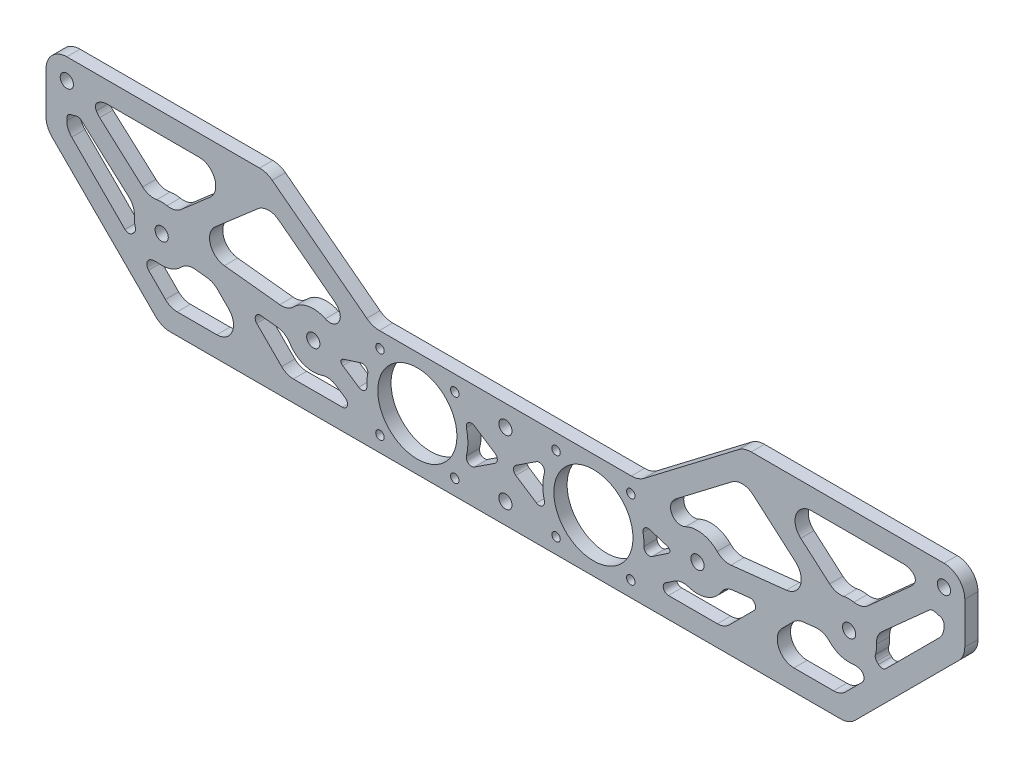
from build123d import *

# Parameters (mm, degrees)
SKETCH1_R           = 14.2875
SKETCH1_R_2         = 3.175
BOSS_EXTRUDE1_DEPTH = 6.35
FILLET1_R           = 10
CUT_EXTRUDE1_DEPTH  = 10
FILLET2_R           = 2.5
FILLET3_DEPTH       = 6.35
FILLET4_R           = 8
FILLET5_R           = 8
FILLET6_R           = 3
FILLET7_R           = 8
FILLET8_R           = 5
FILLET9_R           = 3
FILLET10_R          = 8
SKETCH3_R           = 19
CUT_EXTRUDE2_DEPTH  = 10
SKETCH4_R           = 2.032
CUT_EXTRUDE3_DEPTH  = 10


with BuildPart() as part:
    # Sketch1 → Boss-Extrude1 (new body)
    with BuildSketch(Plane.XY):
        Polygon((-62.442934658, -37.279495554), (267.757065342, -37.279495554), (323.315335232, 18.278774336), (323.315335232, 52.320504446), (217.352871158, 52.320504446), (166.552871158, 13.520504446), (38.761259526, 13.520504446), (-12.038740474, 52.320504446), (-118.001204548, 52.320504446), (-118.001204548, 18.278774336), align=None)
        with Locations((60.373820223, -11.879495554)):
            Circle(SKETCH1_R, mode=Mode.SUBTRACT)
        with Locations((-62.442934658, 1.520504446)):
            Circle(SKETCH1_R_2, mode=Mode.SUBTRACT)
        with Locations((10.373820223, -6.424213816)):
            Circle(SKETCH1_R_2, mode=Mode.SUBTRACT)
        with Locations((102.657065342, -27.279495554)):
            Circle(SKETCH1_R_2, mode=Mode.SUBTRACT)
        with Locations((144.940310462, -11.879495554)):
            Circle(SKETCH1_R, mode=Mode.SUBTRACT)
        with Locations((194.940310462, -6.424213816)):
            Circle(SKETCH1_R_2, mode=Mode.SUBTRACT)
        with Locations((102.657065342, 3.520504446)):
            Circle(SKETCH1_R_2, mode=Mode.SUBTRACT)
        with Locations((267.757065342, 1.520504446)):
            Circle(SKETCH1_R_2, mode=Mode.SUBTRACT)
        with Locations((313.315335232, 42.320504446)):
            Circle(SKETCH1_R_2, mode=Mode.SUBTRACT)
        with Locations((-108.001204548, 42.320504446)):
            Circle(SKETCH1_R_2, mode=Mode.SUBTRACT)
    extrude(amount=BOSS_EXTRUDE1_DEPTH)

    # Fillet1
    fillet1_edges = [part.edges().sort_by_distance(p)[0] for p in [
        (-118.001204548, 18.278774336, 3.175),
        (-118.001204548, 52.320504446, 3.175),
        (-12.038740474, 52.320504446, 3.175),
        (38.761259526, 13.520504446, 3.175),
        (166.552871158, 13.520504446, 3.175),
        (217.352871158, 52.320504446, 3.175),
        (323.315335232, 52.320504446, 3.175),
        (323.315335232, 18.278774336, 3.175),
        (267.757065342, -37.279495554, 3.175),
        (-62.442934658, -37.279495554, 3.175),
    ]]
    fillet(fillet1_edges, radius=FILLET1_R)

    # Sketch2 → Cut-Extrude1 (cut)
    with BuildSketch(Plane.XY.offset(6.35)):
        with BuildLine():
            ThreePointArc((23.505920872, -7.486549706), (23.419545179, -8.265323632), (23.28702714, -9.037585605))
            Line((23.28702714, -9.037585605), (36.905820905, -18.135345959))
            ThreePointArc((36.905820905, -18.135345959), (36.127690836, -10.462503664), (37.794303215, -2.932536966))
            Line((37.794303215, -2.932536966), (23.505920872, -7.486549706))
        make_face()
        with BuildLine():
            Line((-74.858923583, 5.927753475), (-102.256554243, 30.463876853))
            ThreePointArc((-102.256554243, 30.463876853), (-105.054209768, 29.479326667), (-108.001204548, 29.145504446))
            Line((-108.001204548, 29.145504446), (-108.001204548, 22.42090996))
            Line((-108.001204548, 22.42090996), (-78.307400752, -7.272893836))
            Line((-78.307400752, -7.272893836), (-74.597651385, -3.563144469))
            ThreePointArc((-74.597651385, -3.563144469), (-75.612945288, 1.157951013), (-74.858923583, 5.927753475))
        make_face()
        with BuildLine():
            Line((-23.050139283, 42.320504446), (-94.826204548, 42.320504446))
            ThreePointArc((-94.826204548, 42.320504446), (-95.017343814, 40.084439722), (-95.585215622, 37.913255418))
            Line((-95.585215622, 37.913255418), (-68.187584962, 13.377132039))
            ThreePointArc((-68.187584962, 13.377132039), (-62.339595002, 14.695099162), (-56.512999229, 13.285558242))
            Line((-56.512999229, 13.285558242), (-23.050139283, 42.320504446))
        make_face()
        with BuildLine():
            Line((-67.526583573, -10.63421228), (-71.23633294, -14.343961648))
            Line((-71.23633294, -14.343961648), (-58.300799034, -27.279495554))
            Line((-58.300799034, -27.279495554), (-16.619224161, -27.279495554))
            Line((-16.619224161, -27.279495554), (-37.688728757, -6.209990957))
            Line((-37.688728757, -6.209990957), (-50.867789262, -4.772081195))
            ThreePointArc((-50.867789262, -4.772081195), (-58.069603335, -10.907471984), (-67.526583573, -10.63421228))
        make_face()
        with BuildLine():
            Line((30.003625706, 7.626245825), (-11.363222422, 39.221397545))
            Line((-11.363222422, 39.221397545), (-49.959338032, 5.732444651))
            ThreePointArc((-49.959338032, 5.732444651), (-49.868096719, 5.45167168), (-49.783169494, 5.168924788))
            Line((-49.783169494, 5.168924788), (-1.201325173, -0.131628174))
            ThreePointArc((-1.201325173, -0.131628174), (9.059387493, 6.685053578), (20.46921657, 2.041221648))
            Line((20.46921657, 2.041221648), (32.642653903, 5.921156225))
            ThreePointArc((32.642653903, 5.921156225), (31.289604918, 6.721797881), (30.003625706, 7.626245825))
        make_face()
        with BuildLine():
            Line((-21.814640677, -7.941943413), (-2.477088537, -27.279495554))
            Line((-2.477088537, -27.279495554), (32.591759865, -27.279495554))
            Line((32.591759865, -27.279495554), (17.732180345, -17.352853315))
            ThreePointArc((17.732180345, -17.352853315), (5.870863239, -18.805813204), (-2.285944941, -10.072634157))
            Line((-2.285944941, -10.072634157), (-21.814640677, -7.941943413))
        make_face()
        with BuildLine():
            Line((187.581950339, -17.352853315), (172.722370819, -27.279495554))
            Line((172.722370819, -27.279495554), (207.791219222, -27.279495554))
            Line((207.791219222, -27.279495554), (227.128771362, -7.941943413))
            Line((227.128771362, -7.941943413), (207.600075626, -10.072634157))
            ThreePointArc((207.600075626, -10.072634157), (199.443267446, -18.805813204), (187.581950339, -17.352853315))
        make_face()
        with BuildLine():
            Line((243.002859442, -6.209990957), (221.933354845, -27.279495554))
            Line((221.933354845, -27.279495554), (263.614929719, -27.279495554))
            Line((263.614929719, -27.279495554), (276.550463625, -14.343961648))
            Line((276.550463625, -14.343961648), (272.840714257, -10.63421228))
            ThreePointArc((272.840714257, -10.63421228), (263.38373402, -10.907471984), (256.181919946, -4.772081195))
            Line((256.181919946, -4.772081195), (243.002859442, -6.209990957))
        make_face()
        with BuildLine():
            Line((168.408309779, -18.135345959), (182.027103545, -9.037585605))
            ThreePointArc((182.027103545, -9.037585605), (181.894585505, -8.265323632), (181.808209813, -7.486549706))
            Line((181.808209813, -7.486549706), (167.519827469, -2.932536966))
            ThreePointArc((167.519827469, -2.932536966), (169.186439849, -10.462503664), (168.408309779, -18.135345959))
        make_face()
        with BuildLine():
            ThreePointArc((175.310504979, 7.626245825), (174.024525767, 6.721797881), (172.671476782, 5.921156225))
            Line((172.671476782, 5.921156225), (184.844914115, 2.041221648))
            ThreePointArc((184.844914115, 2.041221648), (196.254743191, 6.685053578), (206.515455858, -0.131628174))
            Line((206.515455858, -0.131628174), (255.097300178, 5.168924788))
            ThreePointArc((255.097300178, 5.168924788), (255.182227404, 5.45167168), (255.273468717, 5.732444651))
            Line((255.273468717, 5.732444651), (216.677353107, 39.221397545))
            Line((216.677353107, 39.221397545), (175.310504979, 7.626245825))
        make_face()
        with BuildLine():
            Line((279.911782069, -3.563144469), (283.621531436, -7.272893836))
            Line((283.621531436, -7.272893836), (313.315335232, 22.42090996))
            Line((313.315335232, 22.42090996), (313.315335232, 29.145504446))
            ThreePointArc((313.315335232, 29.145504446), (310.368340453, 29.479326667), (307.570684928, 30.463876853))
            Line((307.570684928, 30.463876853), (280.173054268, 5.927753475))
            ThreePointArc((280.173054268, 5.927753475), (280.927075973, 1.157951013), (279.911782069, -3.563144469))
        make_face()
        with BuildLine():
            Line((228.364269968, 42.320504446), (261.827129914, 13.285558242))
            ThreePointArc((261.827129914, 13.285558242), (267.653725687, 14.695099162), (273.501715647, 13.377132039))
            Line((273.501715647, 13.377132039), (300.899346307, 37.913255418))
            ThreePointArc((300.899346307, 37.913255418), (300.331474499, 40.084439722), (300.140335232, 42.320504446))
            Line((300.140335232, 42.320504446), (228.364269968, 42.320504446))
        make_face()
        with BuildLine():
            Line((124.499254422, 1.237130698), (104.481636284, -11.879495554))
            Line((104.481636284, -11.879495554), (124.499254422, -24.996121805))
            ThreePointArc((124.499254422, -24.996121805), (120.652810462, -11.879495554), (124.499254422, 1.237130698))
        make_face()
        with BuildLine():
            Line((100.832494401, -11.879495554), (80.814876263, 1.237130698))
            ThreePointArc((80.814876263, 1.237130698), (84.661320223, -11.879495554), (80.814876263, -24.996121805))
            Line((80.814876263, -24.996121805), (100.832494401, -11.879495554))
        make_face()
    extrude(amount=-CUT_EXTRUDE1_DEPTH, mode=Mode.SUBTRACT)

    # Fillet2
    # the kernel refuses this fillet: 2.5 mm, written as the material it adds along each edge
    with BuildSketch(Plane(origin=(124.499254422, -24.996121805, 6.35), x_dir=(-0.8364298099761919, 0.5480740579366914, 0), z_dir=(0, 0, -1)), Plane(origin=(80.814876263, 1.237130698, 6.35), x_dir=(0.8364298099761912, -0.5480740579366923, 0), z_dir=(0, 0, -1))) as fillet2_piece_1:
        with BuildLine():
            CenterArc((8.270761151, 2.5), FILLET2_R, 132.738385679, 137.261614321)
            ThreePointArc((6.574131455, 4.336150232), (3.463988922, 1.899838021), (0, 0))
            Line((0, 0), (8.270761151, 0))
        make_face()
    extrude(amount=6.35)
    with BuildSketch(Plane(origin=(104.481636284, -11.879495554, 6.35), x_dir=(0.836429809976191, 0.5480740579366925, 0), z_dir=(0, 0, -1)), Plane(origin=(100.832494401, -11.879495554, 6.35), x_dir=(-0.836429809976192, -0.5480740579366911, 0), z_dir=(0, 0, -1))) as fillet2_piece_2:
        with BuildLine():
            CenterArc((FILLET2_R * 1.52612552604, FILLET2_R), FILLET2_R, 156.469970738, 113.530029262)
            Line((FILLET2_R * 0.609274565772, FILLET2_R * 1.39922965403), (0, 0))
            Line((0, 0), (FILLET2_R * 1.52612552604, 0))
        make_face()
    extrude(amount=6.35)
    with BuildSketch(Plane(origin=(124.499254422, 1.237130698, 6.35), x_dir=(-0.8364298099761911, -0.5480740579366926, 0), z_dir=(0, 0, -1)), Plane(origin=(80.814876263, -24.996121805, 6.35), x_dir=(0.8364298099761913, 0.5480740579366921, 0), z_dir=(0, 0, -1))) as fillet2_piece_3:
        with BuildLine():
            CenterArc((8.270761151, -2.5), FILLET2_R, 90, 137.261614321)
            ThreePointArc((6.574131455, -4.336150232), (3.463988922, -1.899838021), (0, 0))
            Line((0, 0), (8.270761151, 0))
        make_face()
    extrude(amount=6.35)
    with BuildSketch(Plane(origin=(36.905820905, -18.135345959, 6.35), x_dir=(-0.8315267709778132, 0.5554846794891928, 0), z_dir=(0, 0, -1))) as fillet2_piece_4:
        with BuildLine():
            CenterArc((5.637586761, 2.5), FILLET2_R, 144.019234869, 125.980765131)
            ThreePointArc((3.614551073, 3.968784057), (1.917261006, 1.884223289), (0, 0))
            Line((0, 0), (5.637586761, 0))
        make_face()
    extrude(amount=6.35)
    with BuildSketch(Plane(origin=(37.794303215, -2.932536966, 6.35), x_dir=(-0.9527771354410546, -0.3036704302047504, 0), z_dir=(0, 0, -1))) as fillet2_piece_5:
        with BuildLine():
            CenterArc((4.690805929, -2.5), FILLET2_R, 90, 118.741955759)
            ThreePointArc((2.498820236, -3.702164183), (1.334695889, -1.793517434), (0, 0))
            Line((0, 0), (4.690805929, 0))
        make_face()
    extrude(amount=6.35)
    with BuildSketch(Plane(origin=(23.28702714, -9.037585605, 6.35), x_dir=(0.14435302535723496, 0.989526252340085, 0), z_dir=(0, 0, -1)), Plane(origin=(181.808209813, -7.486549706, 6.35), x_dir=(0.13512930422682767, -0.9908279725255911, 0), z_dir=(0, 0, -1)), Plane(origin=(307.570684928, 30.463876853, 6.35), x_dir=(0.9224742738611128, -0.3860585629984297, 0), z_dir=(0, 0, -1))) as fillet2_piece_6:
        with BuildLine():
            CenterArc((1.580869434, 2.496243903), FILLET2_R, 205.444288667, 61.414548907)
            Line((-0.676639225, 1.422160733), (0, 0))
            ThreePointArc((0, 0), (0.721939507, 0.019794629), (1.443879015, 0))
        make_face()
    extrude(amount=6.35)
    with BuildSketch(Plane(origin=(23.505920872, -7.486549706, 6.35), x_dir=(0.9527771354410546, 0.3036704302047506, 0), z_dir=(0, 0, -1)), Plane(origin=(182.027103545, -9.037585605, 6.35), x_dir=(-0.8315267709778119, -0.5554846794891947, 0), z_dir=(0, 0, -1)), Plane(origin=(-74.597651385, -3.563144469, 6.35), x_dir=(-0.7071067811865465, -0.7071067811865487, 0), z_dir=(0, 0, -1)), Plane(origin=(-102.256554243, 30.463876853, 6.35), x_dir=(0.7449378564648427, -0.667133862133804, 0), z_dir=(0, 0, -1))) as fillet2_piece_7:
        with BuildLine():
            CenterArc((1.574922789, 2.5), FILLET2_R, 208.585451093, 61.414548907)
            ThreePointArc((-0.62033846, 1.303827751), (-0.292294611, 0.660418307), (0, 0))
            Line((0, 0), (1.574922789, 0))
        make_face()
    extrude(amount=6.35)
    with BuildSketch(Plane(origin=(168.408309779, -18.135345959, 6.35), x_dir=(0.8315267709778126, 0.555484679489194, 0), z_dir=(0, 0, -1))) as fillet2_piece_8:
        with BuildLine():
            CenterArc((5.637586761, -2.5), FILLET2_R, 90, 125.980765131)
            ThreePointArc((3.614551073, -3.968784057), (1.917261006, -1.884223289), (0, 0))
            Line((0, 0), (5.637586761, 0))
        make_face()
    extrude(amount=6.35)
    with BuildSketch(Plane(origin=(167.519827469, -2.932536966, 6.35), x_dir=(0.9527771354410542, -0.3036704302047514, 0), z_dir=(0, 0, -1))) as fillet2_piece_9:
        with BuildLine():
            CenterArc((4.690805929, 2.5), FILLET2_R, 151.258044241, 118.741955759)
            ThreePointArc((2.498820236, 3.702164183), (1.334695889, 1.793517434), (0, 0))
            Line((0, 0), (4.690805929, 0))
        make_face()
    extrude(amount=6.35)
    with BuildSketch(Plane(origin=(-21.814640677, -7.941943413, 6.35), x_dir=(0.9941005983250841, -0.10846197679237511, 0), z_dir=(0, 0, -1)), Plane(origin=(227.128771362, -7.941943413, 6.35), x_dir=(-0.7071067811865478, -0.7071067811865472, 0), z_dir=(0, 0, -1))) as fillet2_piece_10:
        with BuildLine():
            CenterArc((FILLET2_R * 2.8417642098, FILLET2_R), FILLET2_R, 128.773337141, 141.226662859)
            Line((FILLET2_R * 2.21552313484, FILLET2_R * 1.77962947355), (0, 0))
            Line((0, 0), (FILLET2_R * 2.8417642098, 0))
        make_face()
    extrude(amount=6.35)
    with BuildSketch(Plane(origin=(32.591759865, -27.279495554, 6.35), x_dir=(-1, 0, 0), z_dir=(0, 0, -1)), Plane(origin=(172.722370819, -27.279495554, 6.35), x_dir=(0.8315267709778129, 0.5554846794891936, 0), z_dir=(0, 0, -1))) as fillet2_piece_11:
        with BuildLine():
            CenterArc((FILLET2_R * 3.2971688304, FILLET2_R), FILLET2_R, 123.74410479, 146.25589521)
            Line((FILLET2_R * 2.74168415091, FILLET2_R * 1.83152677098), (0, 0))
            Line((0, 0), (FILLET2_R * 3.2971688304, 0))
        make_face()
    extrude(amount=6.35)
    with BuildSketch(Plane(origin=(279.911782069, -3.563144469, 6.35), x_dir=(0.7071067811865567, -0.7071067811865384, 0), z_dir=(0, 0, -1))) as fillet2_piece_12:
        with BuildLine():
            CenterArc((1.574922789, -2.5), FILLET2_R, 90, 61.414548907)
            ThreePointArc((-0.62033846, -1.303827751), (-0.292294611, -0.660418307), (0, 0))
            Line((0, 0), (1.574922789, 0))
        make_face()
    extrude(amount=6.35)
    with BuildSketch(Plane(origin=(283.621531436, -7.272893836, 6.35), x_dir=(-0.707106781186556, 0.7071067811865389, 0), z_dir=(0, 0, -1))) as fillet2_piece_13:
        with BuildLine():
            CenterArc((FILLET2_R, FILLET2_R), FILLET2_R, 180, 90)
            Line((0, FILLET2_R), (0, 0))
            Line((0, 0), (FILLET2_R, 0))
        make_face()
    extrude(amount=6.35)
    with BuildSketch(Plane(origin=(-78.307400752, -7.272893836, 6.35), x_dir=(0.7071067811865476, 0.7071067811865476, 0), z_dir=(0, 0, -1))) as fillet2_piece_14:
        with BuildLine():
            CenterArc((FILLET2_R, -FILLET2_R), FILLET2_R, 90, 90)
            Line((0, -FILLET2_R), (0, 0))
            Line((0, 0), (FILLET2_R, 0))
        make_face()
    extrude(amount=6.35)
    with BuildSketch(Plane(origin=(-108.001204548, 29.145504446, 6.35), x_dir=(0.996794764075885, 0.08000123943352926, 0), z_dir=(0, 0, -1))) as fillet2_piece_15:
        with BuildLine():
            CenterArc((2.308035758, 2.49198691), FILLET2_R, 184.588636978, 80.822726043)
            Line((-0.183951153, 2.291983812), (0, 0))
            ThreePointArc((0, 0), (1.05401633, 0.042228983), (2.108032659, 0))
        make_face()
    extrude(amount=6.35)
    with BuildSketch(Plane(origin=(313.315335232, 29.145504446, 6.35), x_dir=(0, -1, 0), z_dir=(0, 0, -1))) as fillet2_piece_16:
        with BuildLine():
            CenterArc((2.299353783, 2.5), FILLET2_R, 189.177273957, 80.822726043)
            ThreePointArc((-0.168645225, 2.101275917), (-0.042228983, 1.05401633), (0, 0))
            Line((0, 0), (2.299353783, 0))
        make_face()
    extrude(amount=6.35)

    # Fillet3: read off the stored shape, not the designer's step
    # Fillet3 outline → Fillet3 (add)
    with BuildSketch(Plane.XY):
        with BuildLine():
            ThreePointArc((211.014076866, 0.359196726), (207.431725827, 0.786667832), (204.401466543, 2.744600208))
            ThreePointArc((204.401466543, 2.744600208), (205.556320418, 1.37841123), (206.515455858, -0.131628174))
            Line((206.515455858, -0.131628174), (211.014076866, 0.359196726))
        make_face()
        with BuildLine():
            Line((172.671476782, 5.921156225), (184.844914115, 2.041221648))
            ThreePointArc((184.844914115, 2.041221648), (181.600857992, 8.411550009), (184.744728864, 14.831912887))
            Line((184.744728864, 14.831912887), (175.310504979, 7.626245825))
            ThreePointArc((175.310504979, 7.626245825), (174.024525767, 6.721797881), (172.671476782, 5.921156225))
        make_face()
        with BuildLine():
            ThreePointArc((253.267424296, 7.473042793), (254.289203208, 6.405834356), (255.097300178, 5.168924788))
            ThreePointArc((255.097300178, 5.168924788), (255.182227404, 5.45167168), (255.273468717, 5.732444651))
            Line((255.273468717, 5.732444651), (253.267424296, 7.473042793))
        make_face()
        with BuildLine():
            Line((216.677353107, 39.221397545), (211.499590999, 35.266728848))
            ThreePointArc((211.499590999, 35.266728848), (216.60505587, 36.90513128), (221.598403693, 34.951516272))
            Line((221.598403693, 34.951516272), (216.677353107, 39.221397545))
        make_face()
        with BuildLine():
            ThreePointArc((0.912664141, 2.744600208), (-2.117595142, 0.786667832), (-5.699946181, 0.359196726))
            Line((-5.699946181, 0.359196726), (-1.201325173, -0.131628174))
            ThreePointArc((-1.201325173, -0.131628174), (-0.242189733, 1.37841123), (0.912664141, 2.744600208))
        make_face()
        with BuildLine():
            ThreePointArc((-49.959338032, 5.732444651), (-49.868096719, 5.45167168), (-49.783169494, 5.168924788))
            ThreePointArc((-49.783169494, 5.168924788), (-48.975072523, 6.405834356), (-47.953293611, 7.473042793))
            Line((-47.953293611, 7.473042793), (-49.959338032, 5.732444651))
        make_face()
        with BuildLine():
            ThreePointArc((20.56940182, 14.831912887), (23.713272692, 8.411550009), (20.46921657, 2.041221648))
            Line((20.46921657, 2.041221648), (32.642653903, 5.921156225))
            ThreePointArc((32.642653903, 5.921156225), (31.289604918, 6.721797881), (30.003625706, 7.626245825))
            Line((30.003625706, 7.626245825), (20.56940182, 14.831912887))
        make_face()
        with BuildLine():
            Line((-11.363222422, 39.221397545), (-16.284273008, 34.951516272))
            ThreePointArc((-16.284273008, 34.951516272), (-11.290925185, 36.90513128), (-6.185460314, 35.266728848))
            Line((-6.185460314, 35.266728848), (-11.363222422, 39.221397545))
        make_face()
        with BuildLine():
            Line((-58.300799034, -27.279495554), (-54.987090535, -27.279495554))
            ThreePointArc((-54.987090535, -27.279495554), (-58.048557994, -26.670531814), (-60.643944784, -24.936349803))
            Line((-60.643944784, -24.936349803), (-58.300799034, -27.279495554))
        make_face()
        with BuildLine():
            ThreePointArc((-30.27607841, -13.622641304), (-28.5418964, -22.340963013), (-35.93293266, -27.279495554))
            Line((-35.93293266, -27.279495554), (-16.619224161, -27.279495554))
            Line((-16.619224161, -27.279495554), (-30.27607841, -13.622641304))
        make_face()
        with BuildLine():
            Line((-67.526583573, -10.63421228), (-70.726466387, -13.834095095))
            ThreePointArc((-70.726466387, -13.834095095), (-67.665859968, -11.923948803), (-64.077242842, -11.552737759))
            ThreePointArc((-64.077242842, -11.552737759), (-65.833164615, -11.210833497), (-67.526583573, -10.63421228))
        make_face()
        with BuildLine():
            ThreePointArc((-52.981778576, -7.648309578), (-49.951519293, -5.690377201), (-46.369168254, -5.262906096))
            Line((-46.369168254, -5.262906096), (-50.867789262, -4.772081195))
            ThreePointArc((-50.867789262, -4.772081195), (-51.826924702, -6.2821206), (-52.981778576, -7.648309578))
        make_face()
        with BuildLine():
            Line((221.933354845, -27.279495554), (241.247063344, -27.279495554))
            ThreePointArc((241.247063344, -27.279495554), (233.856027084, -22.340963013), (235.590209095, -13.622641304))
            Line((235.590209095, -13.622641304), (221.933354845, -27.279495554))
        make_face()
        with BuildLine():
            Line((256.181919946, -4.772081195), (251.683298938, -5.262906096))
            ThreePointArc((251.683298938, -5.262906096), (255.265649978, -5.690377201), (258.295909261, -7.648309578))
            ThreePointArc((258.295909261, -7.648309578), (257.141055386, -6.2821206), (256.181919946, -4.772081195))
        make_face()
        with BuildLine():
            ThreePointArc((269.391373527, -11.552737759), (272.979990652, -11.923948803), (276.040597072, -13.834095095))
            Line((276.040597072, -13.834095095), (272.840714257, -10.63421228))
            ThreePointArc((272.840714257, -10.63421228), (271.147295299, -11.210833497), (269.391373527, -11.552737759))
        make_face()
        with BuildLine():
            Line((313.315335232, 22.42090996), (313.315335232, 25.734618459))
            ThreePointArc((313.315335232, 25.734618459), (312.706371492, 22.673151), (310.972189482, 20.077764209))
            Line((310.972189482, 20.077764209), (313.315335232, 22.42090996))
        make_face()
        with BuildLine():
            Line((-108.001204548, 22.42090996), (-105.658058797, 20.077764209))
            ThreePointArc((-105.658058797, 20.077764209), (-107.392240808, 22.673151), (-108.001204548, 25.734618459))
            Line((-108.001204548, 25.734618459), (-108.001204548, 22.42090996))
        make_face()
        with BuildLine():
            ThreePointArc((-94.710843669, 39.231452318), (-91.910717066, 41.506865938), (-88.395577167, 42.320504446))
            Line((-88.395577167, 42.320504446), (-94.826204548, 42.320504446))
            ThreePointArc((-94.826204548, 42.320504446), (-95.017343814, 40.084439722), (-95.585215622, 37.913255418))
            Line((-95.585215622, 37.913255418), (-92.214135174, 34.89426276))
            ThreePointArc((-92.214135174, 34.89426276), (-93.810362745, 36.862603833), (-94.710843669, 39.231452318))
        make_face()
        with BuildLine():
            Line((-23.050139283, 42.320504446), (-44.477079813, 42.320504446))
            ThreePointArc((-44.477079813, 42.320504446), (-36.98241748, 37.118724686), (-39.234150855, 28.278013574))
            Line((-39.234150855, 28.278013574), (-23.050139283, 42.320504446))
        make_face()
        with BuildLine():
            ThreePointArc((-64.794001652, 14.484034405), (-68.39760622, 14.657252847), (-71.55866541, 16.396124697))
            Line((-71.55866541, 16.396124697), (-68.187584962, 13.377132039))
            ThreePointArc((-68.187584962, 13.377132039), (-66.528453946, 14.04604464), (-64.794001652, 14.484034405))
        make_face()
        with BuildLine():
            Line((-56.512999229, 13.285558242), (-53.094975386, 16.251298127))
            ThreePointArc((-53.094975386, 16.251298127), (-56.282922876, 14.562226986), (-59.888801275, 14.445558708))
            ThreePointArc((-59.888801275, 14.445558708), (-58.161433032, 13.980414913), (-56.512999229, 13.285558242))
        make_face()
        with BuildLine():
            ThreePointArc((300.024974354, 39.231452318), (299.12449343, 36.862603833), (297.528265858, 34.89426276))
            Line((297.528265858, 34.89426276), (300.899346307, 37.913255418))
            ThreePointArc((300.899346307, 37.913255418), (300.331474499, 40.084439722), (300.140335232, 42.320504446))
            Line((300.140335232, 42.320504446), (293.709707851, 42.320504446))
            ThreePointArc((293.709707851, 42.320504446), (297.224847751, 41.506865938), (300.024974354, 39.231452318))
        make_face()
        with BuildLine():
            Line((273.501715647, 13.377132039), (276.872796095, 16.396124697))
            ThreePointArc((276.872796095, 16.396124697), (273.711736905, 14.657252847), (270.108132336, 14.484034405))
            ThreePointArc((270.108132336, 14.484034405), (271.842584631, 14.04604464), (273.501715647, 13.377132039))
        make_face()
        with BuildLine():
            ThreePointArc((244.54828154, 28.278013574), (242.296548164, 37.118724686), (249.791210497, 42.320504446))
            Line((249.791210497, 42.320504446), (228.364269968, 42.320504446))
            Line((228.364269968, 42.320504446), (244.54828154, 28.278013574))
        make_face()
        with BuildLine():
            ThreePointArc((261.827129914, 13.285558242), (263.475563717, 13.980414913), (265.202931959, 14.445558708))
            ThreePointArc((265.202931959, 14.445558708), (261.59705356, 14.562226986), (258.409106071, 16.251298127))
            Line((258.409106071, 16.251298127), (261.827129914, 13.285558242))
        make_face()
        with BuildLine():
            ThreePointArc((280.900420623, 2.433103461), (281.468499861, 5.995863135), (283.544134716, 8.946746132))
            Line((283.544134716, 8.946746132), (280.173054268, 5.927753475))
            ThreePointArc((280.173054268, 5.927753475), (280.655637502, 4.205175982), (280.900420623, 2.433103461))
        make_face()
        with BuildLine():
            ThreePointArc((183.819027546, -19.866597953), (187.193607633, -18.590596485), (190.785655576, -18.926992218))
            ThreePointArc((190.785655576, -18.926992218), (189.130245318, -18.248923877), (187.581950339, -17.352853315))
            Line((187.581950339, -17.352853315), (183.819027546, -19.866597953))
        make_face()
        with BuildLine():
            ThreePointArc((206.156066314, -13.337060238), (208.692812831, -10.771736161), (212.098696634, -9.581809257))
            Line((212.098696634, -9.581809257), (207.600075626, -10.072634157))
            ThreePointArc((207.600075626, -10.072634157), (206.989138013, -11.753977379), (206.156066314, -13.337060238))
        make_face()
        with BuildLine():
            ThreePointArc((-6.784565949, -9.581809257), (-3.378682147, -10.771736161), (-0.84193563, -13.337060238))
            ThreePointArc((-0.84193563, -13.337060238), (-1.675007328, -11.753977378), (-2.285944941, -10.072634157))
            Line((-2.285944941, -10.072634157), (-6.784565949, -9.581809257))
        make_face()
        with BuildLine():
            ThreePointArc((17.732180345, -17.352853315), (16.183885366, -18.248923877), (14.528475108, -18.926992218))
            ThreePointArc((14.528475108, -18.926992218), (18.120523051, -18.590596485), (21.495103139, -19.866597953))
            Line((21.495103139, -19.866597953), (17.732180345, -17.352853315))
        make_face()
        with BuildLine():
            ThreePointArc((-78.230004032, 8.946746132), (-76.154369176, 5.995863135), (-75.586289939, 2.433103461))
            ThreePointArc((-75.586289939, 2.433103461), (-75.341506817, 4.205175982), (-74.858923583, 5.927753475))
            Line((-74.858923583, 5.927753475), (-78.230004032, 8.946746132))
        make_face()
    extrude(amount=FILLET3_DEPTH)

    # Fillet4
    fillet4_edges = [part.edges().sort_by_distance(p)[0] for p in [
        (-49.783169494, 5.168924788, 3.175),
        (255.097300178, 5.168924788, 3.175),
    ]]
    fillet(fillet4_edges, radius=FILLET4_R)

    # Fillet5
    # the kernel refuses this fillet: 8 mm, written as the material it adds along each edge
    with BuildSketch(Plane(origin=(276.550463625, -14.343961648, 6.35), x_dir=(-0.7071067811865465, -0.7071067811865486, 0), z_dir=(0, 0, -1))) as fillet5_piece_1:
        with BuildLine():
            CenterArc((3.319191964, 8), FILLET5_R, 245.487044087, 24.512955913)
            Line((0, 0.721060194), (-0.066383839, 0.575481398))
            ThreePointArc((-0.066383839, 0.575481398), (-0.16, 0.360530097), (-0.16, 0))
            Line((-0.16, 0), (0, -0.16))
            Line((0, -0.16), (3.319191964, -0.16))
            Line((3.319191964, -0.16), (3.319191964, 0))
        make_face()
    extrude(amount=6.35)
    with BuildSketch(Plane(origin=(-71.23633294, -14.343961648, 6.35), x_dir=(0.7071067811865467, -0.7071067811865483, 0), z_dir=(0, 0, -1))) as fillet5_piece_2:
        with BuildLine():
            CenterArc((3.319191965, -8), FILLET5_R, 90, 24.512955918)
            Line((0, -0.721060194), (-0.066383839, -0.575481398))
            ThreePointArc((-0.066383839, -0.575481398), (-0.16, -0.360530097), (-0.16, 0))
            Line((-0.16, 0), (0, 0.16))
            Line((0, 0.16), (3.319191965, 0.16))
            Line((3.319191965, 0.16), (3.319191965, 0))
        make_face()
    extrude(amount=6.35)

    # Fillet6
    fillet6_edges = [part.edges().sort_by_distance(p)[0] for p in [
        (276.040597072, -13.834095095, 3.175),
        (-70.726466387, -13.834095095, 3.175),
    ]]
    fillet(fillet6_edges, radius=FILLET6_R)

    # Fillet7
    fillet7_edges = [part.edges().sort_by_distance(p)[0] for p in [
        (-2.477088537, -27.279495554, 3.175),
        (207.791219222, -27.279495554, 3.175),
        (263.614929719, -27.279495554, 3.175),
    ]]
    fillet(fillet7_edges, radius=FILLET7_R)

    # Fillet8
    fillet8_edges = [part.edges().sort_by_distance(p)[0] for p in [
        (184.844914115, 2.041221648, 3.175),
        (20.46921657, 2.041221648, 3.175),
    ]]
    fillet(fillet8_edges, radius=FILLET8_R)

    # Fillet9
    fillet9_edges = [part.edges().sort_by_distance(p)[0] for p in [
        (-94.710843669, 39.231452318, 3.175),
        (300.024974354, 39.231452318, 3.175),
    ]]
    fillet(fillet9_edges, radius=FILLET9_R)

    # Fillet10
    fillet10_edges = [part.edges().sort_by_distance(p)[0] for p in [
        (-37.688728757, -6.209990957, 3.175),
        (243.002859442, -6.209990957, 3.175),
    ]]
    fillet(fillet10_edges, radius=FILLET10_R)

    # Sketch3 → Cut-Extrude2 (cut)
    with BuildSketch(Plane(origin=(0, 0, 0), x_dir=(-1, 0, 0), z_dir=(0, 0, -1))):
        with Locations((-144.940310462, -11.879495554)):
            Circle(SKETCH3_R)
        with Locations((-60.373820223, -11.879495554)):
            Circle(SKETCH3_R)
    extrude(amount=-CUT_EXTRUDE2_DEPTH, mode=Mode.SUBTRACT)

    # Sketch4 → Cut-Extrude3 (cut)
    with BuildSketch(Plane(origin=(0, 0, 0), x_dir=(-1, 0, 0), z_dir=(0, 0, -1))):
        with Locations((-126.97979822, 6.081016689)):
            Circle(SKETCH4_R)
        with Locations((-42.413307981, 6.081016689)):
            Circle(SKETCH4_R)
        with Locations((-126.97979822, -29.840007796)):
            Circle(SKETCH4_R)
        with Locations((-162.900822704, -29.840007796)):
            Circle(SKETCH4_R)
        with Locations((-162.900822704, 6.081016689)):
            Circle(SKETCH4_R)
        with Locations((-42.413307981, -29.840007796)):
            Circle(SKETCH4_R)
        with Locations((-78.334332465, -29.840007796)):
            Circle(SKETCH4_R)
        with Locations((-78.334332465, 6.081016689)):
            Circle(SKETCH4_R)
    extrude(amount=-CUT_EXTRUDE3_DEPTH, mode=Mode.SUBTRACT)


solid = part.part
